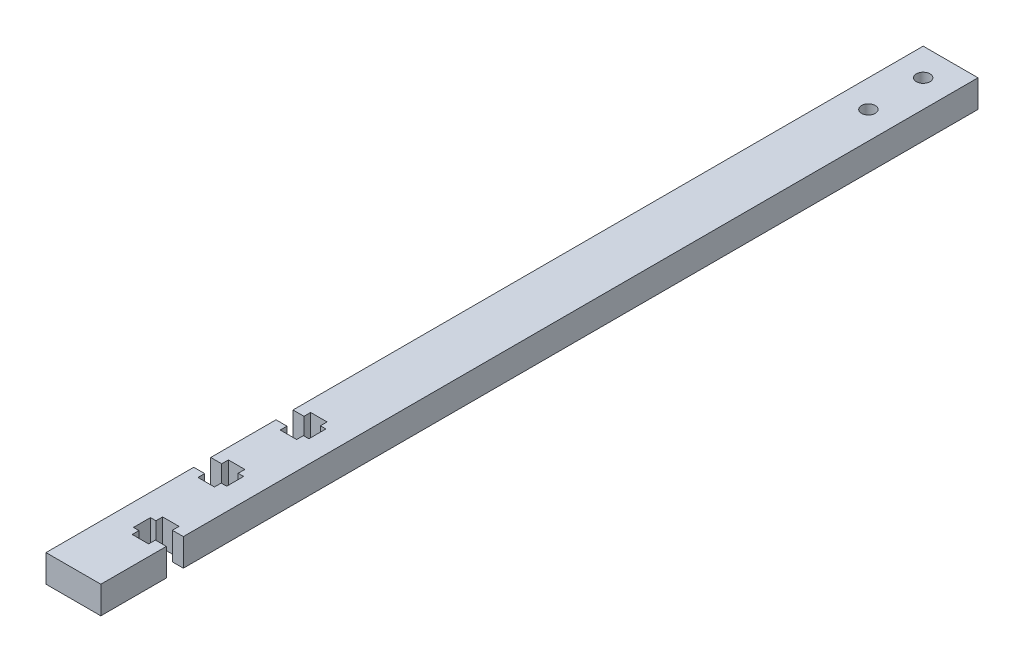
from build123d import *

# Parameters (mm, degrees)
ESQUISSE1_W             = 10
ESQUISSE1_H             = 5
BOSS_EXTRU_1_DEPTH      = 160
ESQUISSE2_R             = 1.25
ENL_V_MAT_EXTRU_1_DEPTH = 10


with BuildPart() as part:
    # Esquisse1 → Boss.-Extru.1 (new body)
    with BuildSketch(Plane.XY):
        with Locations((5, 2.5)):
            Rectangle(ESQUISSE1_W, ESQUISSE1_H)
    extrude(amount=BOSS_EXTRU_1_DEPTH)

    # Esquisse2 → Enlèv. mat.-Extru.1 (cut)
    with BuildSketch(Plane(origin=(0, 5, 0), x_dir=(1, 0, 0), z_dir=(0, 1, 0))):
        Polygon((10, -148.05), (10, -144.95), (8, -144.95), (8, -143.73), (5, -143.73), (5, -144.95), (4, -144.95), (4, -148.05), (5, -148.05), (5, -149.28), (8, -149.28), (8, -148.05), align=None)
        Polygon((0, -114.95), (0, -118.05), (2, -118.05), (2, -119.28), (5, -119.28), (5, -118.05), (6, -118.05), (6, -114.95), (5, -114.95), (5, -113.73), (2, -113.73), (2, -114.95), align=None)
        Polygon((2, -129.95), (0, -129.95), (0, -133.05), (2, -133.05), (2, -134.28), (5, -134.28), (5, -133.05), (6, -133.05), (6, -129.95), (5, -129.95), (5, -128.73), (2, -128.73), align=None)
        with Locations((5, -5)):
            Circle(ESQUISSE2_R)
        with Locations((5, -15)):
            Circle(ESQUISSE2_R)
    extrude(amount=-ENL_V_MAT_EXTRU_1_DEPTH, mode=Mode.SUBTRACT)


solid = part.part
